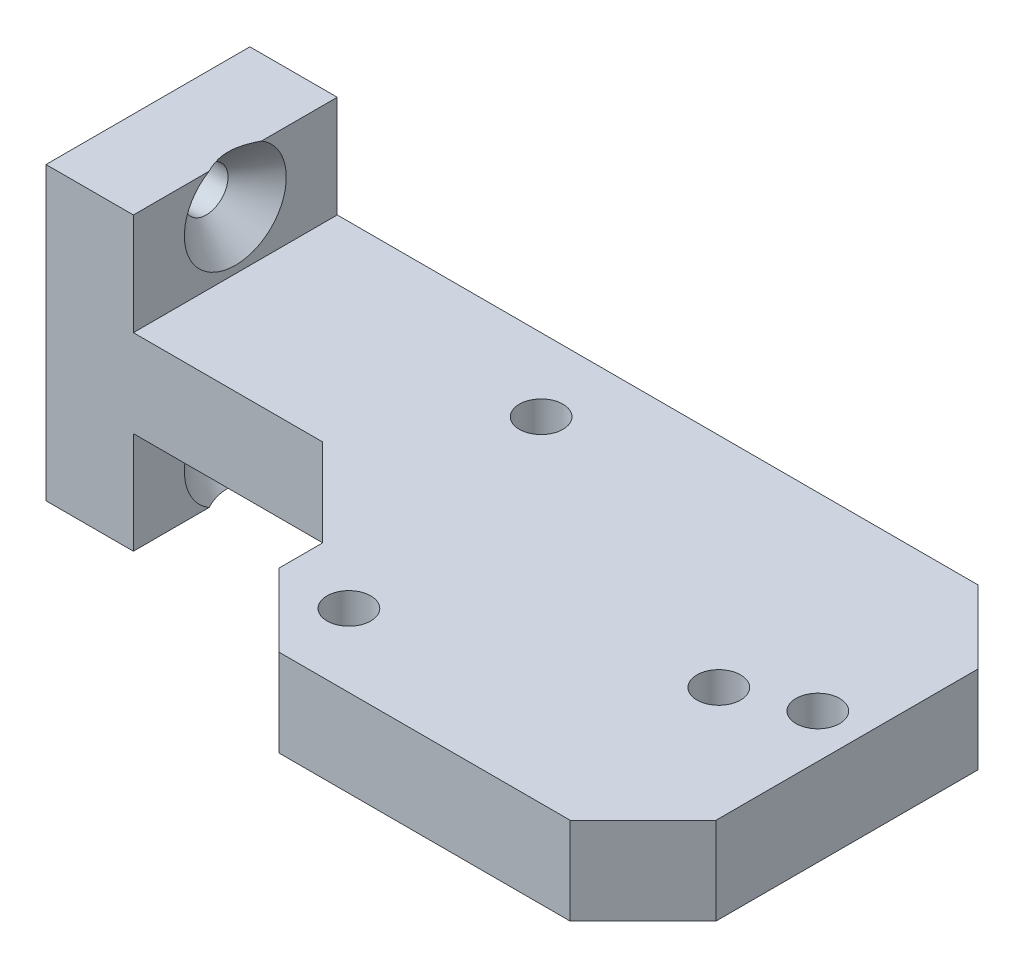
from build123d import *

# Parameters (mm, degrees)
SKETCH_1_R      = 1.5
EXTRUDE_1_DEPTH = 3
SKETCH_2_W      = 14
SKETCH_2_H      = 20
SKETCH_2_R      = 1.5
EXTRUDE_2_DEPTH = 6
CHAMFER_1_SIZE  = 2
CHAMFER_2_SIZE  = 6
CHAMFER_3_SIZE  = 5


with BuildPart() as part:
    # 草图1 → 凸台-拉伸1 (new, symmetric)
    with BuildSketch(Plane(origin=(0, 0, 0), x_dir=(1, 0, 0), z_dir=(0, 1, 0))):
        Polygon((0, 14), (0, 0), (25, 0), (25, -14), (55, -14), (55, 14), align=None)
        with Locations(Location((25, 9, 0), (0, 0, 270))):
            Circle(SKETCH_1_R, mode=Mode.SUBTRACT)
        with Locations(Location((52, 1, 0), (0, 0, 270))):
            Circle(SKETCH_1_R, mode=Mode.SUBTRACT)
        with Locations(Location((29.8, -9, 0), (0, 0, 270))):
            Circle(SKETCH_1_R, mode=Mode.SUBTRACT)
        with Locations(Location((47.2, -1, 0), (0, 0, 270))):
            Circle(SKETCH_1_R, mode=Mode.SUBTRACT)
    extrude(amount=EXTRUDE_1_DEPTH, both=True)

    # 草图2 → 凸台-拉伸2 (add)
    with BuildSketch(Plane(origin=(0, 0, 0), x_dir=(0, 0, -1), z_dir=(1, 0, 0))):
        with Locations((7, 0)):
            Rectangle(SKETCH_2_W, SKETCH_2_H)
        with Locations((7, 7)):
            Circle(SKETCH_2_R, mode=Mode.SUBTRACT)
        with Locations((7, -7)):
            Circle(SKETCH_2_R, mode=Mode.SUBTRACT)
    extrude(amount=EXTRUDE_2_DEPTH)

    # 倒角1
    # the kernel refuses this chamfer: 2 mm, written as the material it takes off along each edge
    with BuildSketch(Plane(origin=(6, 7, -7), x_dir=(0, 0, -1), z_dir=(0, -1, 0))) as chamfer_1_piece_1:
        Polygon((1.5, -CHAMFER_1_SIZE), (1.5 + CHAMFER_1_SIZE, 0), (1.5, 0), align=None)
    revolve(axis=Axis((6, 7, -7), (1, 0, 0)), mode=Mode.SUBTRACT)
    with BuildSketch(Plane(origin=(6, -7, -7), x_dir=(0, 0, -1), z_dir=(0, -1, 0))) as chamfer_1_piece_2:
        Polygon((1.5 + CHAMFER_1_SIZE, 0), (1.5, -CHAMFER_1_SIZE), (1.5, 0), align=None)
    revolve(axis=Axis((6, -7, -7), (1, 0, 0)), mode=Mode.SUBTRACT)

    # 倒角2
    chamfer_2_edges = [part.edges().sort_by_distance(p)[0] for p in [
        (25, 0, 0),
    ]]
    chamfer(chamfer_2_edges, length=CHAMFER_2_SIZE)

    # 倒角3
    chamfer_3_edges = [part.edges().sort_by_distance(p)[0] for p in [
        (55, 0, -14),
        (55, 0, 14),
        (25, 0, 14),
    ]]
    chamfer(chamfer_3_edges, length=CHAMFER_3_SIZE)


solid = part.part
